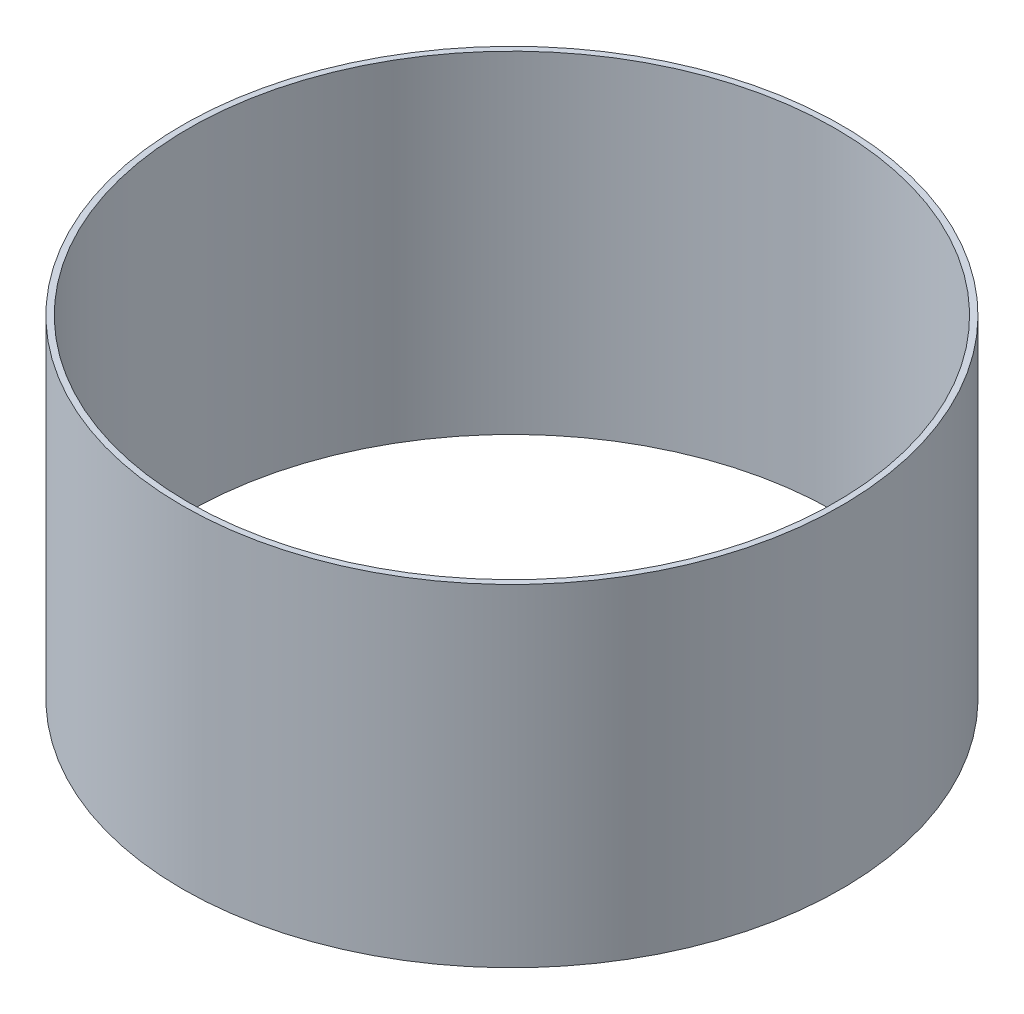
from build123d import *

# Parameters (mm, degrees)
SKETCH1_R           = 88.265
SKETCH1_R_2         = 86.6775
BOSS_EXTRUDE1_DEPTH = 88.9


with BuildPart() as part:
    # Sketch1 → Boss-Extrude1 (new body)
    with BuildSketch(Plane(origin=(0, 0, 0), x_dir=(1, 0, 0), z_dir=(0, 1, 0))):
        Circle(SKETCH1_R)
        Circle(SKETCH1_R_2, mode=Mode.SUBTRACT)
    extrude(amount=BOSS_EXTRUDE1_DEPTH)


solid = part.part
